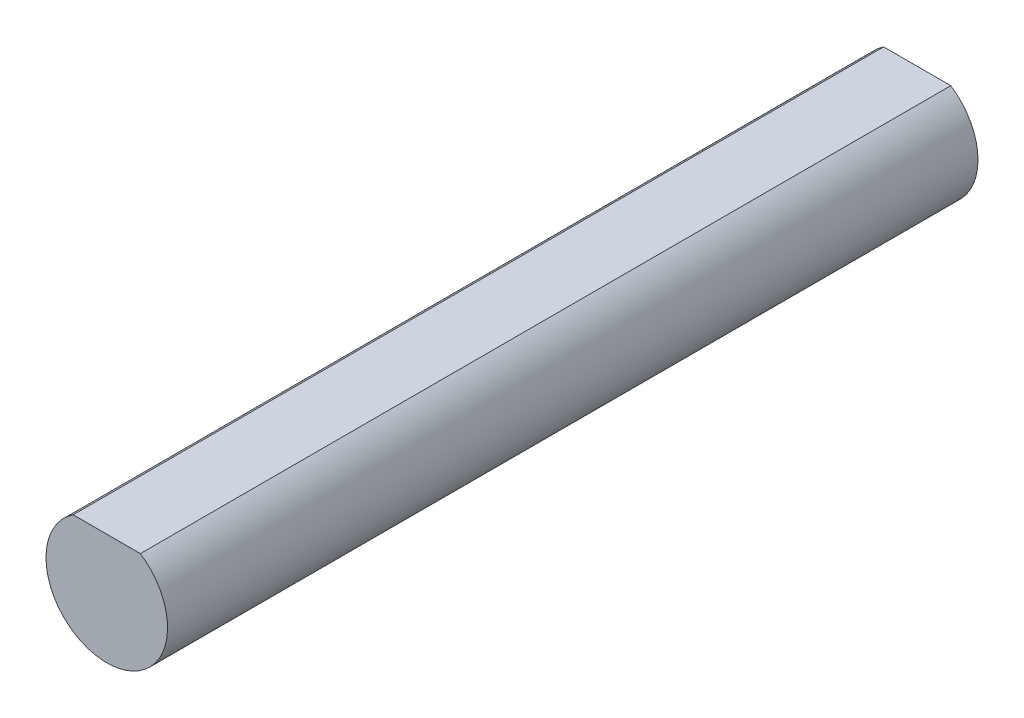
from build123d import *

# Parameters (mm, degrees)
BOSS_EXTRUDE1_DEPTH = 40


with BuildPart() as part:
    # Sketch1 → Boss-Extrude1 (new body)
    with BuildSketch(Plane.XY):
        with BuildLine():
            Line((-1.658312395, 2.5), (1.658312395, 2.5))
            ThreePointArc((1.658312395, 2.5), (0, -3), (-1.658312395, 2.5))
        make_face()
    extrude(amount=BOSS_EXTRUDE1_DEPTH)


solid = part.part
